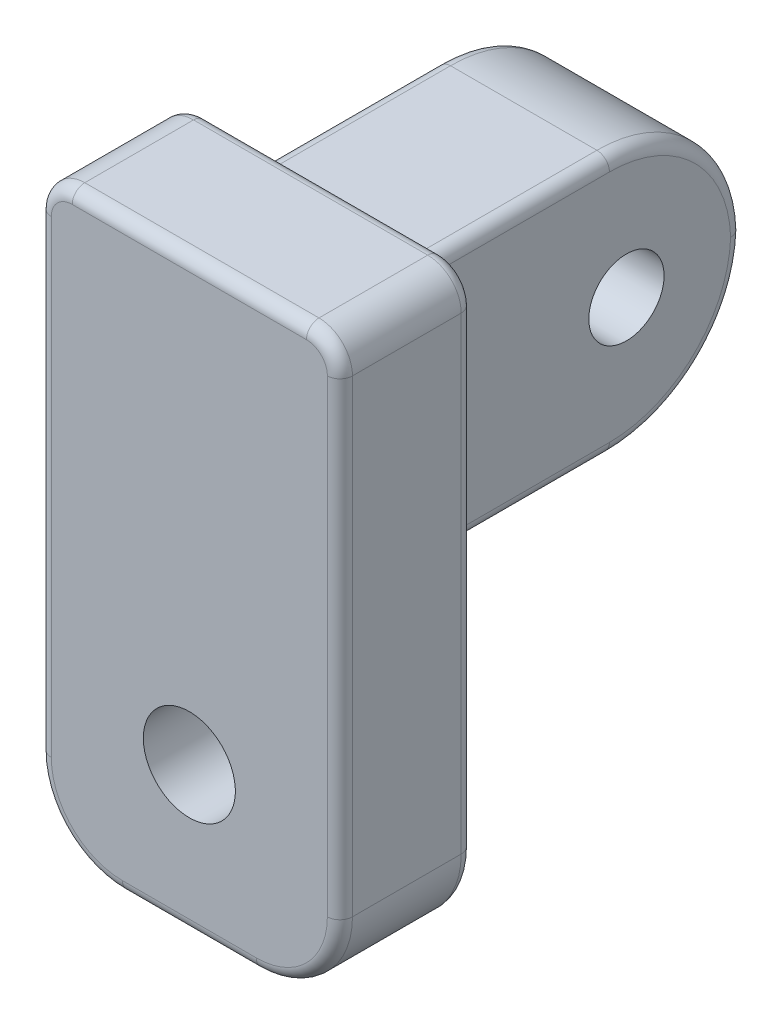
from build123d import *

# Parameters (mm, degrees)
BOSS_EXTRUDE1_DEPTH = 8
SKETCH2_R           = 2.2500000000000058
BOSS_EXTRUDE2_DEPTH = 5.125
FILLET1_R           = 10
FILLET5_R           = 5
FILLET6_R           = 2
SKETCH5_R           = 2.749999999999998
CUT_EXTRUDE1_DEPTH  = 29.057975693196408
SKETCH5_3_R         = 5.000000000000001
SKETCH5_3_R_2       = 2.749999999999998
CUT_EXTRUDE2_DEPTH  = 3
CUT_EXTRUDE3_DEPTH  = 31.095940340849967
FILLET8_R           = 8
FILLET11_R          = 0.75


# Some blends are built 0.0001 mm under size
with BuildPart() as part:
    # Sketch1 → Boss-Extrude1 (new body)
    with BuildSketch(Plane.XY):
        Polygon((-9, 17.500000000000004), (9, 17.500000000000004), (9.000000000000004, -17.499999999999996), (-8.999999999999996, -17.499999999999996), align=None)
    extrude(amount=BOSS_EXTRUDE1_DEPTH)

    # Sketch2 → Boss-Extrude2 (add, symmetric)
    with BuildSketch(Plane(origin=(0, 0, 0), x_dir=(0, 0, -1), z_dir=(1, 0, 0))):
        Polygon((0, 17.500000000000004), (20, 17.500000000000007), (20.000000000000007, -2.499999999999992), (2.14e-15, -2.499999999999992), align=None)
        with Locations((13.000000000000002, 7.500000000000007)):
            Circle(SKETCH2_R, mode=Mode.SUBTRACT)
    extrude(amount=BOSS_EXTRUDE2_DEPTH, both=True)

    # Fillet1
    fillet1_edges = [part.edges().sort_by_distance(p)[0] for p in [
        (0, 17.500000000000007, -20),
        (0, -2.499999999999992, -20.000000000000007),
    ]]
    fillet(fillet1_edges, radius=FILLET1_R - 0.0001)  # a hair under: the kernel refuses the full size

    # Fillet5
    fillet5_edges = [part.edges().sort_by_distance(p)[0] for p in [
        (9.000000000000004, -17.499999999999996, 4),
        (-8.999999999999996, -17.499999999999996, 4),
    ]]
    fillet(fillet5_edges, radius=FILLET5_R)

    # Fillet6
    fillet6_edges = [part.edges().sort_by_distance(p)[0] for p in [
        (-9, 17.500000000000004, 4),
        (9, 17.500000000000004, 4),
    ]]
    fillet(fillet6_edges, radius=FILLET6_R)

    # Sketch5 → Cut-Extrude1 (cut, through all)
    with BuildSketch(Plane(origin=(0, 0, 0), x_dir=(-1, 0, 0), z_dir=(0, 0, -1))):
        with Locations((0, -8.75)):
            Circle(SKETCH5_R)
    extrude(amount=-CUT_EXTRUDE1_DEPTH, mode=Mode.SUBTRACT)

    # Sketch5<3> → Cut-Extrude2 (cut)
    with BuildSketch(Plane(origin=(0, 0, 0), x_dir=(-1, 0, 0), z_dir=(0, 0, -1))):
        with Locations((0, -8.75)):
            Circle(SKETCH5_3_R)
        with Locations((0, -8.75)):
            Circle(SKETCH5_3_R_2, mode=Mode.SUBTRACT)
    extrude(amount=-CUT_EXTRUDE2_DEPTH, mode=Mode.SUBTRACT)

    # Sketch6 → Cut-Extrude3 (cut, through all)
    with BuildSketch(Plane(origin=(5.125, 0, 0), x_dir=(0, 0, -1), z_dir=(1, 0, 0))):
        Polygon((0, 17.500000000000004), (20, 17.500000000000004), (20.000000000000004, 15.250000000000005), (2.8e-16, 15.250000000000005), align=None)
        Polygon((19.999999999999996, -2.499999999999992), (20.000000000000004, -0.24999999999998807), (7.21e-15, -0.24999999999999156), (6.94e-15, -2.499999999999992), align=None)
    extrude(amount=-CUT_EXTRUDE3_DEPTH, mode=Mode.SUBTRACT)

    # Fillet8
    # the kernel refuses this fillet: 8 mm, written as the material it takes off along each edge
    with BuildSketch(Plane(origin=(29.35923701875709, -0.2499999999999887, -16.31967672633224), x_dir=(0, -1.5e-16, 1), z_dir=(-1, 0, 0))) as fillet8_piece_1:
        with BuildLine():
            CenterArc((4.335351436704053, 8), FILLET8_R, 172.8217708442513, 97.17822915574868)
            Line((-3.6019465867097984, 8.99964998249916), (-4.395676389051184, 9.099614980749076))
            ThreePointArc((-4.395676389051184, 9.099614980749076), (-4.480323273667765, 7.750099999999992), (-0.5055711938185182, -0.6199981999819997))
            Line((-0.5055711938185182, -0.6199981999819997), (1.2e-16, -0.8))
            Line((1.2e-16, -0.8), (4.335351436704052, -0.8))
            Line((4.335351436704052, -0.8), (4.335351436704052, 0))
        make_face()
    extrude(amount=58.718474037514184, mode=Mode.SUBTRACT)
    with BuildSketch(Plane(origin=(29.35923701875702, 15.250000000000005, -16.31967672633223), x_dir=(0, -0.9284024472828977, -0.37157623158529146), z_dir=(-1, 0, 0))) as fillet8_piece_2:
        with BuildLine():
            CenterArc((5.816306028814807, 6.9975607363498025), FILLET8_R, 201.81286045411787, 97.17822915574845)
            Line((-1.610913549448369, 4.024950883667459), (-2.3536355072746873, 3.727689898399224))
            Line((-2.3536355072746873, 3.727689898399224), (-0.7427219578263171, -0.29726098526823275))
            Line((-0.7427219578263171, -0.29726098526823275), (-0.38774960717711915, -0.6997501283558207))
            ThreePointArc((-0.38774960717711915, -0.6997501283558207), (8.859993445000528, -1.2797901394825208), (10.081433685371605, -0.6997560736349794))
            Line((10.081433685371605, -0.6997560736349794), (9.693694807502807, 5.1e-16))
        make_face()
    extrude(amount=58.71847403751404, mode=Mode.SUBTRACT)

    # Fillet11
    fillet11_edges = [part.edges().sort_by_distance(p)[0] for p in [
        (5.125, -0.2499999999999905, -5.9921626448140035),
        (-5.125, -0.24999999999999029, -5.9921626448140035),
        (5.125, 12.994562646523407, -17.552089652471594),
        (5.125, 2.00543735344751, -17.5520896524431),
        (-5.125, 12.994562646523407, -17.552089652471594),
        (-5.125, 2.00543735344751, -17.5520896524431),
        (0, 17.500000000000004, 0),
        (9.000000000000002, 1.5000000000000036, 0),
        (9.000000000000002, 1.5000000000000036, 8),
        (3.55e-15, -17.499999999999996, 0),
        (-7.535533905932736, -16.035533905932734, 0),
        (7.535533905932741, -16.035533905932734, 0),
        (3.55e-15, -17.499999999999996, 8),
        (-7.535533905932736, -16.035533905932734, 8),
        (7.535533905932741, -16.035533905932734, 8),
        (-8.999999999999998, 1.5000000000000036, 0),
        (-8.999999999999998, 1.5000000000000036, 8),
        (8.414213562373096, 16.9142135623731, 0),
        (-8.414213562373096, 16.9142135623731, 0),
        (0, 17.500000000000004, 8),
        (8.414213562373096, 16.9142135623731, 8),
        (-8.414213562373096, 16.9142135623731, 8),
        (-5.125, 7.500000000000006, -1.07e-15),
        (5.125, 7.500000000000006, -1.07e-15),
        (-5.125, 15.250000000000005, -5.992162644814096),
        (0, 15.250000000000005, -2.8e-16),
        (5.125, 15.250000000000005, -5.992162644814096),
        (0, -0.24999999999999156, -7.21e-15),
    ]]
    fillet(fillet11_edges, radius=FILLET11_R)


solid = part.part
